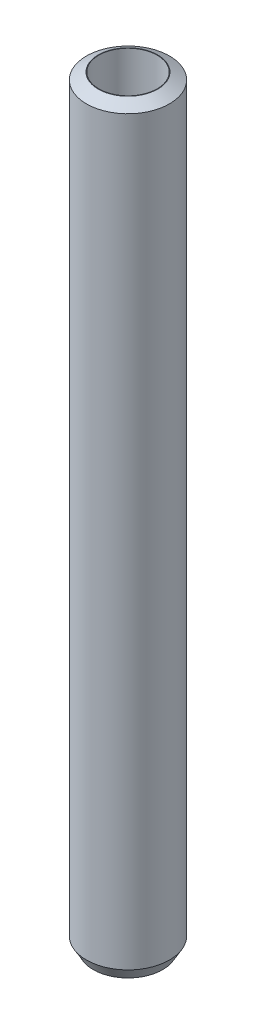
from build123d import *
from OCP.BRepFilletAPI import BRepFilletAPI_MakeChamfer

# Parameters (mm, degrees)
SKETCH1_R           = 25
BOSS_EXTRUDE1_DEPTH = 457.707368058
SKETCH2_R           = 17.571939555
CUT_EXTRUDE1_DEPTH  = 460.070838514
CHAMFER1_SIZE       = 4.109898503
CHAMFER1_SIZE2      = 7.118553021


with BuildPart() as part:
    # Sketch1 → Boss-Extrude1 (new body)
    with BuildSketch(Plane(origin=(0, 0, 0), x_dir=(1, 0, 0), z_dir=(0, 1, 0))):
        Circle(SKETCH1_R)
    extrude(amount=BOSS_EXTRUDE1_DEPTH)

    # Sketch2 → Cut-Extrude1 (cut, through all)
    with BuildSketch(Plane(origin=(0, 0, 0), x_dir=(1, 0, 0), z_dir=(0, 1, 0))):
        Circle(SKETCH2_R)
    extrude(amount=CUT_EXTRUDE1_DEPTH, mode=Mode.SUBTRACT)

    # Chamfer1: one chamfer whose edges measure the first distance from different faces: ONE call of the kernel's chamfer builder (chamfer() names one face for all edges)
    chamfer1_edges_1 = [part.edges().sort_by_distance(p)[0] for p in [
        (-25, 457.707368058, 0),
    ]]
    chamfer1_side_1 = [part.faces().sort_by_distance(p)[0] for p in [
        (-25, 228.853684029, 0),
    ]]
    chamfer1_edges_2 = [part.edges().sort_by_distance(p)[0] for p in [
        (-25, 0, 0),
    ]]
    chamfer1_side_2 = [part.faces().sort_by_distance(p)[0] for p in [
        (-24.292893219, 0, 0),
    ]]
    chamfer1 = BRepFilletAPI_MakeChamfer(part.part.solid().wrapped)
    for e in chamfer1_edges_1:
        chamfer1.Add(CHAMFER1_SIZE, CHAMFER1_SIZE2, e.wrapped, chamfer1_side_1[0].wrapped)  # the first distance lies on this face
    for e in chamfer1_edges_2:
        chamfer1.Add(CHAMFER1_SIZE, CHAMFER1_SIZE2, e.wrapped, chamfer1_side_2[0].wrapped)  # the first distance lies on this face
    add(Compound.cast(chamfer1.Shape()), mode=Mode.REPLACE)


solid = part.part
